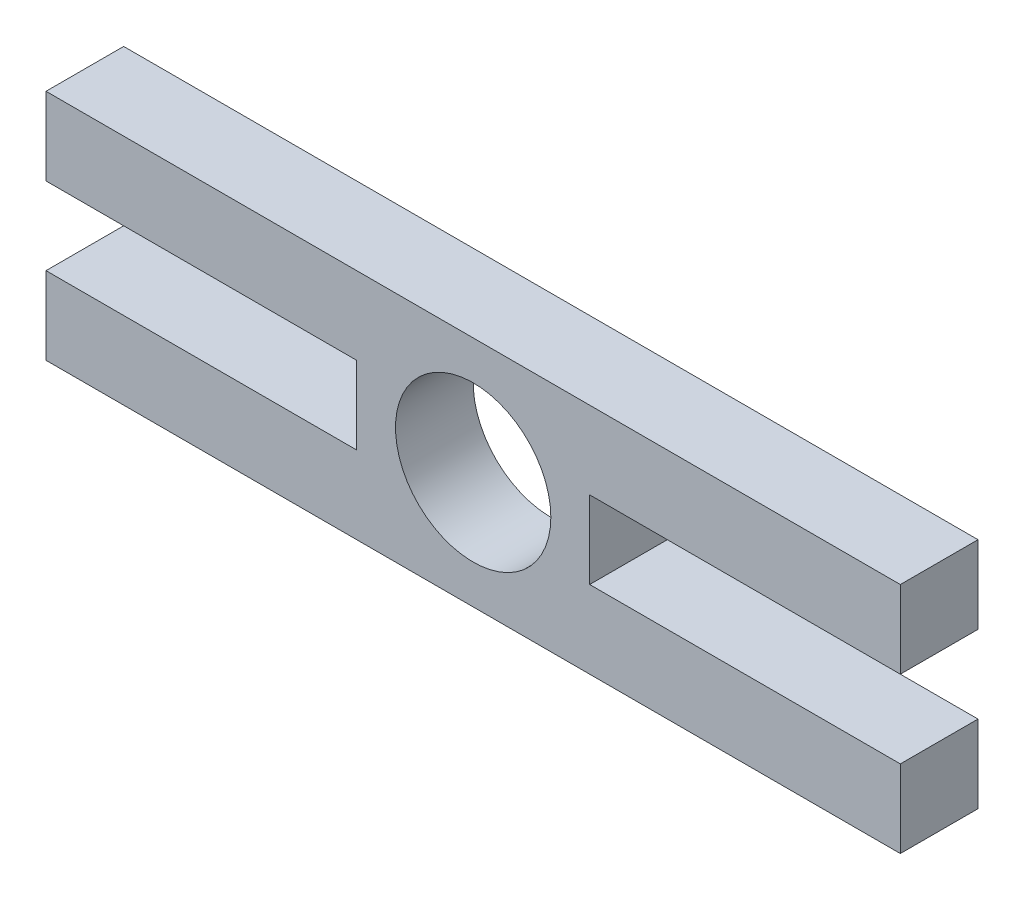
from build123d import *

# Parameters (mm, degrees)
SKETCH1_R           = 12.7
BOSS_EXTRUDE1_DEPTH = 12.7


with BuildPart() as part:
    # Sketch1 → Boss-Extrude1 (new body)
    with BuildSketch(Plane.XY):
        Polygon((-50.8, 0), (-50.8, 6.35), (0, 6.35), (0, 19.05), (-50.8, 19.05), (-50.8, 25.4), (-50.8, 31.75), (19.05, 31.75), (88.9, 31.75), (88.9, 25.4), (88.9, 19.05), (38.1, 19.05), (38.1, 6.35), (88.9, 6.35), (88.9, 0), (88.9, -6.35), (19.05, -6.35), (-50.8, -6.35), align=None)
        with Locations((19.05, 12.7)):
            Circle(SKETCH1_R, mode=Mode.SUBTRACT)
    extrude(amount=BOSS_EXTRUDE1_DEPTH)


solid = part.part
